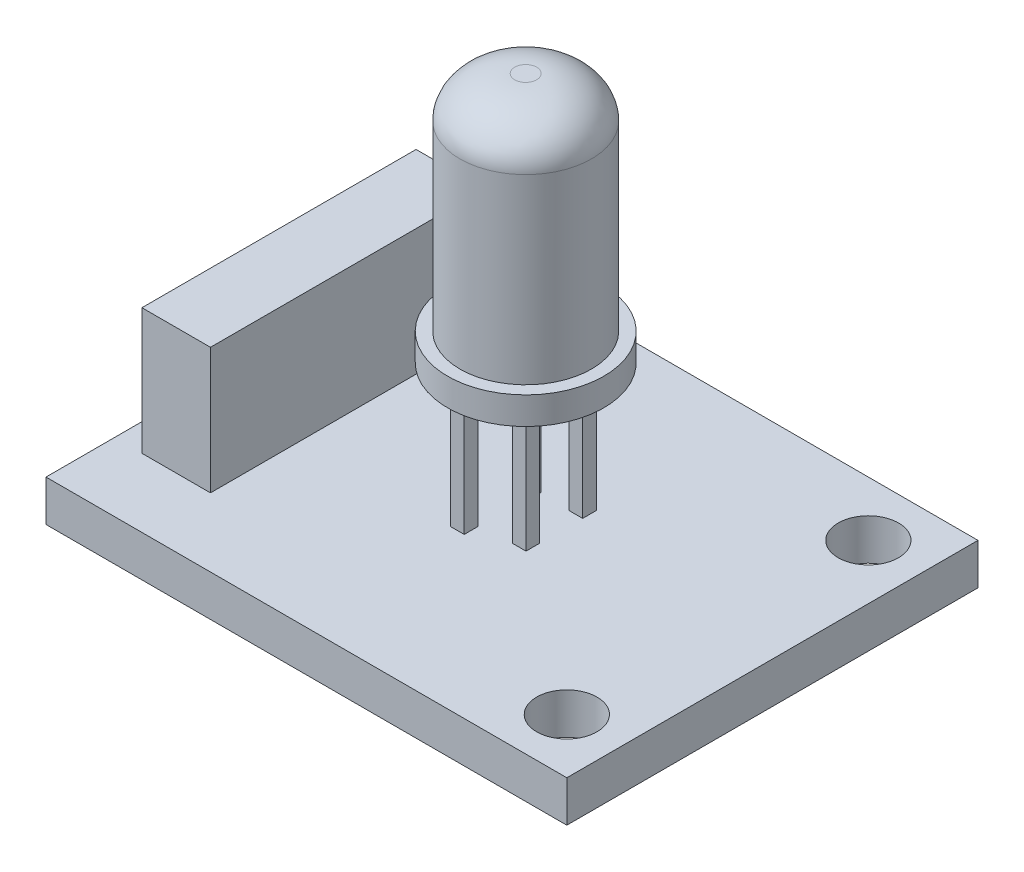
from build123d import *

# Parameters (mm, degrees)
SKETCH_1_W          = 19
SKETCH_1_H          = 15
SKETCH_1_R          = 1.1
EXTRUDE_1_DEPTH     = 1.5
SKETCH_1_4_R        = 2.4
EXTRUDE_2_DEPTH     = 14
SKETCH_1_5_R        = 2.85
EXTRUDE_3_DEPTH     = 5.86
SKETCH_1_7_R        = 2.85
CUT_EXTRUDE_1_DEPTH = 4.86
SKETCH_1_8_W        = 0.5
SKETCH_1_8_H        = 0.5
EXTRUDE_4_DEPTH     = 4.86
FILLET_3_SIZE       = 1.5
FILLET_3_SIZE_2     = 2
SKETCH_1_9_W        = 2.5
SKETCH_1_9_H        = 10
EXTRUDE_5_DEPTH     = 4.6


with BuildPart() as part:
    # 草图1 → 凸台-拉伸1 (new body)
    with BuildSketch(Plane(origin=(0, 0, 0), x_dir=(1, 0, 0), z_dir=(0, 1, 0))):
        with Locations((9.5, 7.5)):
            Rectangle(SKETCH_1_W, SKETCH_1_H)
        with Locations(Location((17, 13, 0), (0, 0, 270))):
            Circle(SKETCH_1_R, mode=Mode.SUBTRACT)
        with Locations(Location((17, 2, 0), (0, 0, 270))):
            Circle(SKETCH_1_R, mode=Mode.SUBTRACT)
    extrude(amount=-EXTRUDE_1_DEPTH)

    # 草图1<4> → 凸台-拉伸2 (add)
    with BuildSketch(Plane(origin=(0, 0, 0), x_dir=(1, 0, 0), z_dir=(0, 1, 0))):
        with Locations(Location((10, 7.5, 0), (0, 0, 270))):
            Circle(SKETCH_1_4_R)
    extrude(amount=EXTRUDE_2_DEPTH)

    # 草图1<5> → 凸台-拉伸3 (add)
    with BuildSketch(Plane(origin=(0, 0, 0), x_dir=(1, 0, 0), z_dir=(0, 1, 0))):
        with Locations(Location((10, 7.5, 0), (0, 0, 90))):
            Circle(SKETCH_1_5_R)
    extrude(amount=EXTRUDE_3_DEPTH)

    # 草图1<7> → 切除-拉伸1 (cut)
    with BuildSketch(Plane(origin=(0, 0, 0), x_dir=(1, 0, 0), z_dir=(0, 1, 0))):
        with Locations(Location((10, 7.5, 0), (0, 0, 90))):
            Circle(SKETCH_1_7_R)
    extrude(amount=CUT_EXTRUDE_1_DEPTH, mode=Mode.SUBTRACT)


with BuildPart() as cut_extrude_1_piece_1:
    # of the separate pieces the step leaves, piece 1, a body of its own (cut_extrude_1_pieces)
    add(part.part.solids().sort_by_distance((0, 0, 0))[0])



with BuildPart() as cut_extrude_1_piece_2:
    # of the separate pieces the step leaves, piece 2, a body of its own (cut_extrude_1_pieces)
    add(part.part.solids().sort_by_distance((10, 4.86, -10.35))[0])


with BuildPart() as cut_extrude_1_piece_1_1:
    add(cut_extrude_1_piece_1.part)

    add(cut_extrude_1_piece_2.part)  # 凸台-拉伸4 merges 切除-拉伸1 piece 2
    # 草图1<8> → 凸台-拉伸4 (add)
    with BuildSketch(Plane(origin=(0, 0, 0), x_dir=(1, 0, 0), z_dir=(0, 1, 0))):
        with Locations((9.262196887, 8.297981086)):
            Rectangle(SKETCH_1_8_W, SKETCH_1_8_H)
        with Locations((9.191679648, 6.064699679)):
            Rectangle(SKETCH_1_8_W, SKETCH_1_8_H)
        with Locations((10.845962172, 6.664377094)):
            Rectangle(SKETCH_1_8_W, SKETCH_1_8_H)
        with Locations((10.845962172, 8.732230249)):
            Rectangle(SKETCH_1_8_W, SKETCH_1_8_H)
    extrude(amount=EXTRUDE_4_DEPTH)

    # 圆角3
    # an asymmetric fillet: 2, 1.5 mm, written as the material it takes off along each edge
    with BuildSketch(Plane(origin=(10, 14, -7.5), x_dir=(0, 0, 1), z_dir=(-1, 0, 0))) as fillet_3_piece_1:
        with BuildLine():
            Bezier((2.4, -FILLET_3_SIZE), (2.4, 0), (2.4 - FILLET_3_SIZE_2, 0), weights=[1, 0.707106781, 1])
            Line((2.4 - FILLET_3_SIZE_2, 0), (2.4, 0))
            Line((2.4, 0), (2.4, -FILLET_3_SIZE))
        make_face()
    revolve(axis=Axis((10, 14, -7.5), (0, 1, 0)), mode=Mode.SUBTRACT)

    # 草图1<9> → 凸台-拉伸5 (add)
    with BuildSketch(Plane(origin=(0, 0, 0), x_dir=(1, 0, 0), z_dir=(0, 1, 0))):
        with Locations((2.25, 7.5)):
            Rectangle(SKETCH_1_9_W, SKETCH_1_9_H)
    extrude(amount=EXTRUDE_5_DEPTH)


solid = cut_extrude_1_piece_1_1.part
